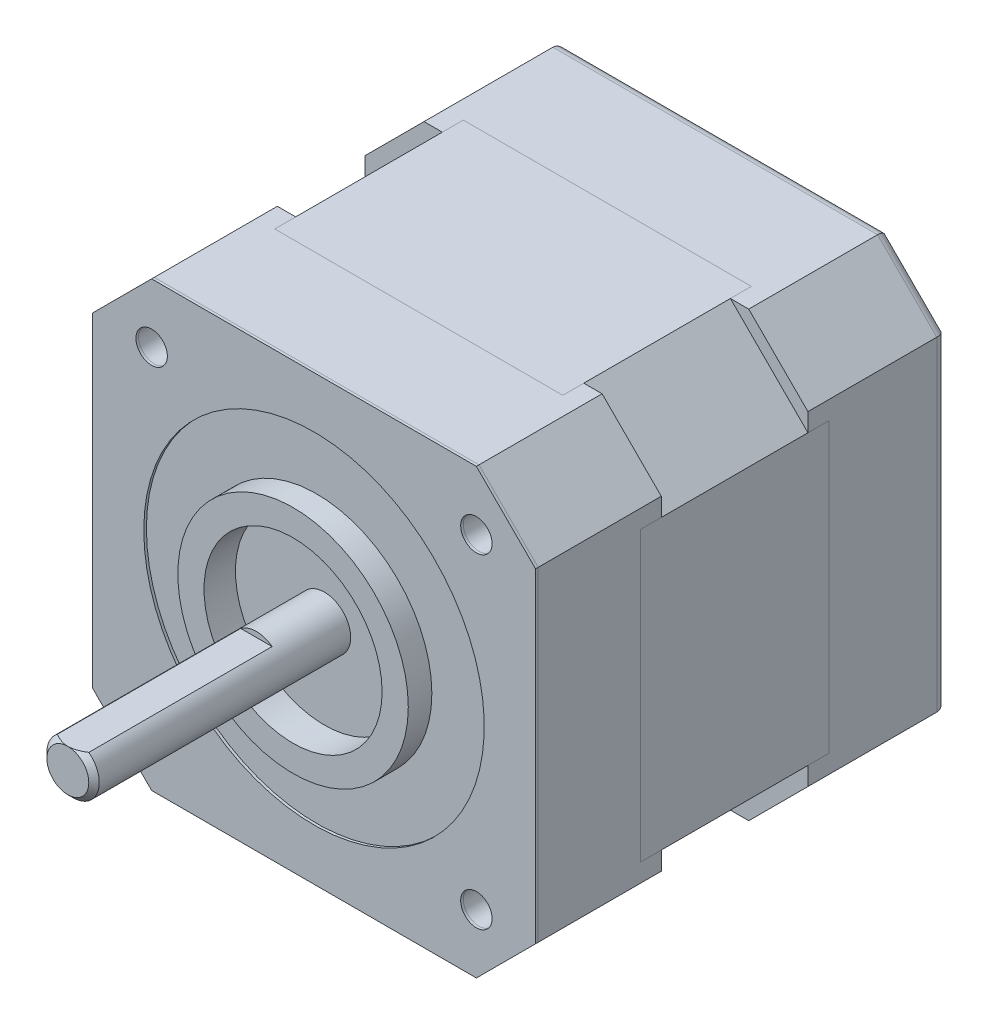
from build123d import *

# Parameters (mm, degrees)
BOSS_EXTRUDE1_DEPTH      = 2
BOSS_EXTRUDE1_DEPTH_BACK = 0.25
SKETCH1_R                = 11
SKETCH1_R_2              = 8.5
SKETCH2_R                = 1.5
SKETCH2_R_2              = 16.25
BOSS_EXTRUDE3_DEPTH      = 0.25
SKETCH2_7_R              = 1.5
SKETCH2_7_R_2            = 16.25
SKETCH2_7_R_3            = 11
SKETCH2_7_R_4            = 8.5
BOSS_EXTRUDE5_DEPTH      = 0.75
SKETCH3_R                = 1.5
BOSS_EXTRUDE6_DEPTH      = 9
BOSS_EXTRUDE7_DEPTH      = 11
BOSS_EXTRUDE9_OUTLINE_R  = 1.5
BOSS_EXTRUDE9_DEPTH      = 18
BOSS_EXTRUDE10_DEPTH     = 2
BOSS_EXTRUDE10_2_DEPTH   = 2
BOSS_EXTRUDE10_3_DEPTH   = 2
BOSS_EXTRUDE10_4_DEPTH   = 2
SKETCH7_3_R              = 1.5
BOSS_EXTRUDE11_DEPTH     = 11.3
SKETCH8_R                = 2.5
BOSS_EXTRUDE13_DEPTH     = 24.5
CHAMFER1_SIZE            = 0.5
CUT_EXTRUDE1_DEPTH       = 18
SKETCH10_W               = 16
SKETCH10_H               = 4
BOSS_EXTRUDE14_DEPTH     = 4.5
FILLET1_R                = 1
SKETCH11_W               = 15
SKETCH11_H               = 6
BOSS_EXTRUDE15_DEPTH     = 6.5


# Read off the part's stored shape, not the designer's step: Boss-Extrude9
with BuildPart() as part:
    # Sketch1 → Boss-Extrude1 (new, two sides: drawn at the far end of the back side and taken through both)
    with BuildSketch(Plane.XY.offset(-BOSS_EXTRUDE1_DEPTH_BACK)):
        Circle(SKETCH1_R)
        Circle(SKETCH1_R_2, mode=Mode.SUBTRACT)
    extrude(amount=BOSS_EXTRUDE1_DEPTH + BOSS_EXTRUDE1_DEPTH_BACK)

    # Sketch2<7> → Boss-Extrude5 (add)
    # profile 1 of 3: a face of its own
    with BuildSketch(Plane(origin=(0, 0, -0.25), x_dir=(-1, 0, 0), z_dir=(0, 0, -1))):
        Polygon((-21.15, -15.5), (-21.15, 0), (-21.15, 15.5), (-15.5, 21.15), (0, 21.15), (15.5, 21.15), (21.15, 15.5), (21.15, 0), (21.15, -15.5), (15.5, -21.15), (0, -21.15), (-15.5, -21.15), align=None)
        with Locations((-15.5, -15.5)):
            Circle(SKETCH2_7_R, mode=Mode.SUBTRACT)
        with Locations((15.5, -15.5)):
            Circle(SKETCH2_7_R, mode=Mode.SUBTRACT)
        with Locations((15.5, 15.5)):
            Circle(SKETCH2_7_R, mode=Mode.SUBTRACT)
        with Locations((-15.5, 15.5)):
            Circle(SKETCH2_7_R, mode=Mode.SUBTRACT)
        Circle(SKETCH2_7_R_2, mode=Mode.SUBTRACT)
    # profile 2 of 3: a face of its own
    with BuildSketch(Plane(origin=(0, 0, -0.25), x_dir=(-1, 0, 0), z_dir=(0, 0, -1))):
        Circle(SKETCH2_7_R_2)
        with Locations(Location((0, 0, 0), (0, 0, 180))):
            Circle(SKETCH2_7_R_3, mode=Mode.SUBTRACT)
    # profile 3 of 3: a face of its own
    with BuildSketch(Plane(origin=(0, 0, -0.25), x_dir=(-1, 0, 0), z_dir=(0, 0, -1))):
        with Locations(Location((0, 0, 0), (0, 0, 180))):
            Circle(SKETCH2_7_R_3)
        with Locations(Location((0, 0, 0), (0, 0, 180))):
            Circle(SKETCH2_7_R_4, mode=Mode.SUBTRACT)
    extrude(amount=BOSS_EXTRUDE5_DEPTH)

    # Sketch3 → Boss-Extrude6 (add)
    with BuildSketch(Plane(origin=(0, 0, -1), x_dir=(-1, 0, 0), z_dir=(0, 0, -1))):
        Polygon((-21.15, 13.75), (-21.15, -13.75), (-13.75, -21.15), (13.75, -21.15), (21.15, -13.75), (21.15, 13.75), (13.75, 21.15), (-13.75, 21.15), align=None)
        with Locations((-15.5, -15.5)):
            Circle(SKETCH3_R, mode=Mode.SUBTRACT)
        with Locations((15.5, -15.5)):
            Circle(SKETCH3_R, mode=Mode.SUBTRACT)
        with Locations((-15.5, 15.5)):
            Circle(SKETCH3_R, mode=Mode.SUBTRACT)
        with Locations((15.5, 15.5)):
            Circle(SKETCH3_R, mode=Mode.SUBTRACT)
    extrude(amount=BOSS_EXTRUDE6_DEPTH)

    # Sketch3<3> → Boss-Extrude7 (add)
    with BuildSketch(Plane(origin=(0, 0, -1), x_dir=(-1, 0, 0), z_dir=(0, 0, -1))):
        Polygon((-21.15, 15.5), (-21.15, 13.75), (-13.75, 21.15), (-15.5, 21.15), align=None)
        Polygon((15.5, 21.15), (13.75, 21.15), (21.15, 13.75), (21.15, 15.5), align=None)
        Polygon((21.15, -13.75), (13.75, -21.15), (15.5, -21.15), (21.15, -15.5), align=None)
        Polygon((-13.75, -21.15), (-21.15, -13.75), (-21.15, -15.5), (-15.5, -21.15), align=None)
    extrude(amount=BOSS_EXTRUDE7_DEPTH)


with BuildPart() as body_2:
    # Sketch2 → Boss-Extrude3 (new body)
    with BuildSketch(Plane(origin=(0, 0, -0.25), x_dir=(-1, 0, 0), z_dir=(0, 0, -1))):
        Polygon((-21.15, -15.5), (-21.15, 0), (-21.15, 15.5), (-15.5, 21.15), (0, 21.15), (15.5, 21.15), (21.15, 15.5), (21.15, 0), (21.15, -15.5), (15.5, -21.15), (0, -21.15), (-15.5, -21.15), align=None)
        with Locations((-15.5, -15.5)):
            Circle(SKETCH2_R, mode=Mode.SUBTRACT)
        with Locations((15.5, -15.5)):
            Circle(SKETCH2_R, mode=Mode.SUBTRACT)
        with Locations((15.5, 15.5)):
            Circle(SKETCH2_R, mode=Mode.SUBTRACT)
        with Locations((-15.5, 15.5)):
            Circle(SKETCH2_R, mode=Mode.SUBTRACT)
        Circle(SKETCH2_R_2, mode=Mode.SUBTRACT)
    extrude(amount=-BOSS_EXTRUDE3_DEPTH)


with BuildPart() as body_3:
    # Boss-Extrude9 outline → Boss-Extrude9 (new body)
    with BuildSketch(Plane(origin=(0, 0, -10), x_dir=(-1, 0, 0), z_dir=(0, 0, -1))):
        Polygon((-21.15, 13.75), (-21.15, -13.75), (-13.75, -21.15), (13.75, -21.15), (21.15, -13.75), (21.15, 13.75), (13.75, 21.15), (-13.75, 21.15), align=None)
        with Locations((-15.5, -15.5)):
            Circle(BOSS_EXTRUDE9_OUTLINE_R, mode=Mode.SUBTRACT)
        with Locations((15.5, -15.5)):
            Circle(BOSS_EXTRUDE9_OUTLINE_R, mode=Mode.SUBTRACT)
        with Locations((-15.5, 15.5)):
            Circle(BOSS_EXTRUDE9_OUTLINE_R, mode=Mode.SUBTRACT)
        with Locations((15.5, 15.5)):
            Circle(BOSS_EXTRUDE9_OUTLINE_R, mode=Mode.SUBTRACT)
    extrude(amount=BOSS_EXTRUDE9_DEPTH)


with BuildPart() as body_4:
    # Sketch7 → Boss-Extrude10 (new body)
    with BuildSketch(Plane(origin=(0, 0, -28), x_dir=(-1, 0, 0), z_dir=(0, 0, -1))):
        Polygon((-15.5, 21.15), (-13.75, 21.15), (-21.15, 13.75), (-21.15, 15.5), align=None)
    extrude(amount=-BOSS_EXTRUDE10_DEPTH)



with BuildPart() as body_5:
    # Sketch7 → Boss-Extrude10 2 (new body)
    with BuildSketch(Plane(origin=(0, 0, -28), x_dir=(-1, 0, 0), z_dir=(0, 0, -1))):
        Polygon((21.15, 15.5), (21.15, 13.75), (13.75, 21.15), (15.5, 21.15), align=None)
    extrude(amount=-BOSS_EXTRUDE10_2_DEPTH)


with BuildPart() as body_6:
    # Sketch7 → Boss-Extrude10 3 (new body)
    with BuildSketch(Plane(origin=(0, 0, -28), x_dir=(-1, 0, 0), z_dir=(0, 0, -1))):
        Polygon((15.5, -21.15), (13.75, -21.15), (21.15, -13.75), (21.15, -15.5), align=None)
    extrude(amount=-BOSS_EXTRUDE10_3_DEPTH)


with BuildPart() as body_7:
    # Sketch7 → Boss-Extrude10 4 (new body)
    with BuildSketch(Plane(origin=(0, 0, -28), x_dir=(-1, 0, 0), z_dir=(0, 0, -1))):
        Polygon((-21.15, -15.5), (-21.15, -13.75), (-13.75, -21.15), (-15.5, -21.15), align=None)
    extrude(amount=-BOSS_EXTRUDE10_4_DEPTH)


with BuildPart() as body_4_1:
    add(body_4.part)

    add(body_7.part)  # Boss-Extrude11 merges body 7

    add(body_6.part)  # Boss-Extrude11 merges body 6

    add(body_5.part)  # Boss-Extrude11 merges body 5
    # Sketch7<3> → Boss-Extrude11 (add)
    with BuildSketch(Plane(origin=(0, 0, -28), x_dir=(-1, 0, 0), z_dir=(0, 0, -1))):
        Polygon((-15.5, 21.15), (-21.15, 15.5), (-21.15, -15.5), (-15.5, -21.15), (15.5, -21.15), (21.15, -15.5), (21.15, 15.5), (15.5, 21.15), align=None)
        with Locations((-15.5, -15.5)):
            Circle(SKETCH7_3_R, mode=Mode.SUBTRACT)
        with Locations((15.5, -15.5)):
            Circle(SKETCH7_3_R, mode=Mode.SUBTRACT)
        with Locations((-15.5, 15.5)):
            Circle(SKETCH7_3_R, mode=Mode.SUBTRACT)
        with Locations((15.5, 15.5)):
            Circle(SKETCH7_3_R, mode=Mode.SUBTRACT)
    extrude(amount=BOSS_EXTRUDE11_DEPTH)

    # Sketch10 → Boss-Extrude14 (add)
    with BuildSketch(Plane(origin=(0, 0, -39.3), x_dir=(-1, 0, 0), z_dir=(0, 0, -1))):
        with Locations((0, -23.15)):
            Rectangle(SKETCH10_W, SKETCH10_H)
    extrude(amount=-BOSS_EXTRUDE14_DEPTH)

    # Fillet1
    fillet1_edges = [body_4_1.edges().sort_by_distance(p)[0] for p in [
        (0, 21.15, -39.3),
        (18.325, 18.325, -39.3),
        (21.15, 0, -39.3),
        (18.325, -18.325, -39.3),
        (-18.325, -18.325, -39.3),
        (-18.325, 18.325, -39.3),
        (-14, -15.5, -39.3),
        (-14, 15.5, -39.3),
        (11.75, -21.15, -39.3),
        (-21.15, 0, -39.3),
        (17, 15.5, -39.3),
        (17, -15.5, -39.3),
        (-11.75, -21.15, -39.3),
        (-8, -23.15, -39.3),
        (8, -23.15, -39.3),
        (0, -25.15, -39.3),
    ]]
    fillet(fillet1_edges, radius=FILLET1_R)


with BuildPart() as body_5_2:
    # Sketch8 → Boss-Extrude13 (new body)
    with BuildSketch(Plane.XY.offset(-1)):
        with Locations(Location((0, 0, 0), (0, 0, 180))):
            Circle(SKETCH8_R)
    extrude(amount=BOSS_EXTRUDE13_DEPTH)

    # Chamfer1
    chamfer1_edges = [body_5_2.edges().sort_by_distance(p)[0] for p in [
        (2.5, 0, 23.5),
    ]]
    chamfer(chamfer1_edges, length=CHAMFER1_SIZE)

    # Sketch9 → Cut-Extrude1 (cut)
    with BuildSketch(Plane.XY.offset(23.5)):
        with BuildLine():
            Line((-1.5, 2), (1.5, 2))
            ThreePointArc((1.5, 2), (0, 2.5), (-1.5, 2))
        make_face()
    extrude(amount=-CUT_EXTRUDE1_DEPTH, mode=Mode.SUBTRACT)


with BuildPart() as body_6_2:
    # Sketch11 → Boss-Extrude15 (new body)
    with BuildSketch(Plane.XY.offset(-34.8)):
        with Locations((0, -24.15)):
            Rectangle(SKETCH11_W, SKETCH11_H)
    extrude(amount=BOSS_EXTRUDE15_DEPTH)


solid = Compound([part.part, body_2.part, body_3.part, body_4_1.part, body_5_2.part, body_6_2.part])
